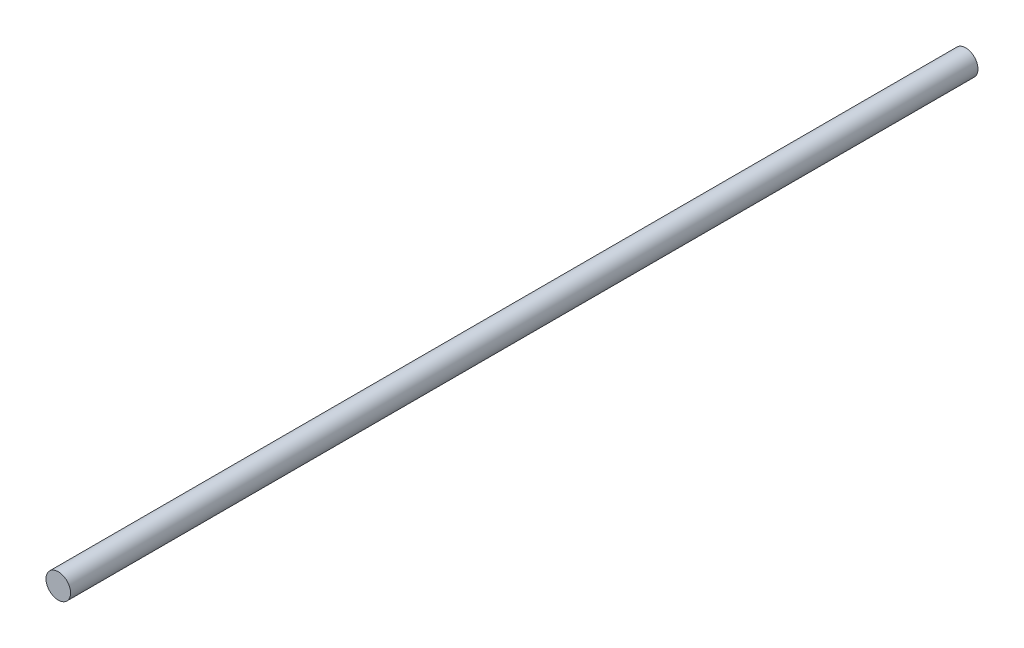
from build123d import *

# Parameters (mm, degrees)
SKETCH1_R           = 4
BOSS_EXTRUDE1_DEPTH = 295


with BuildPart() as part:
    # Sketch1 → Boss-Extrude1 (new body)
    with BuildSketch(Plane.XY):
        Circle(SKETCH1_R)
    extrude(amount=BOSS_EXTRUDE1_DEPTH)


solid = part.part
